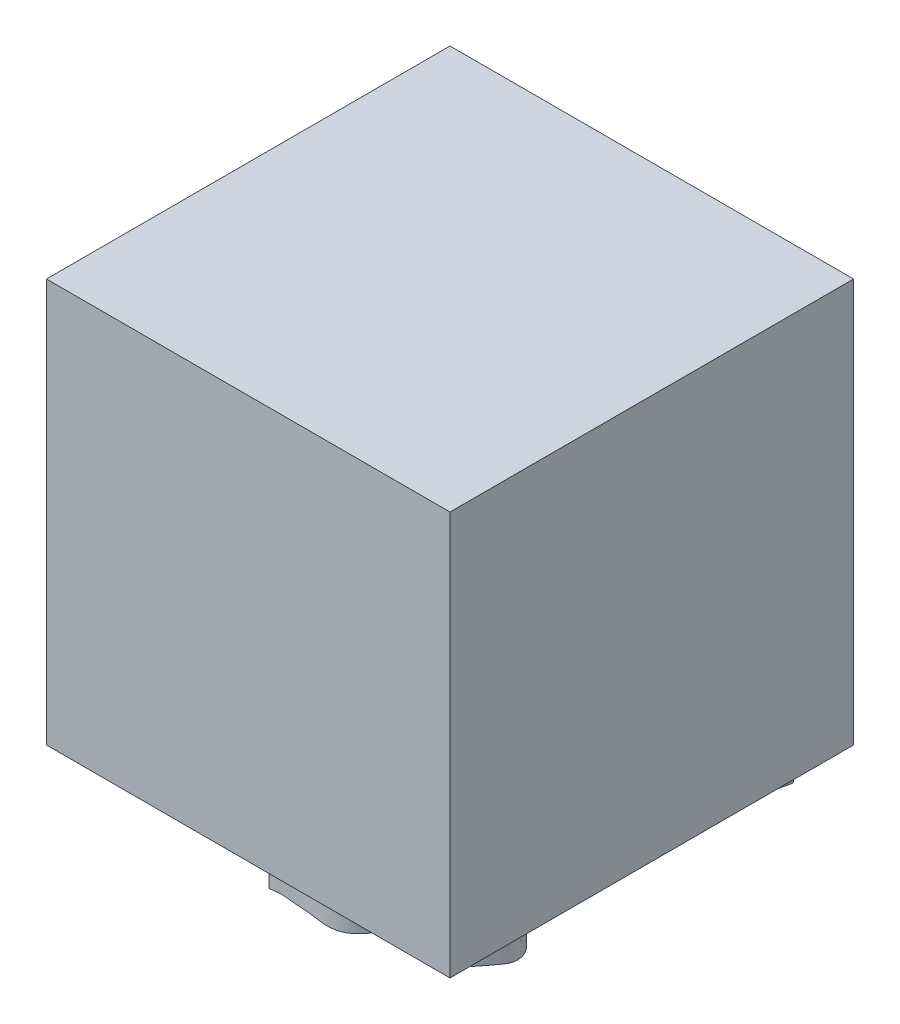
from build123d import *

# Parameters (mm, degrees)
SKETCH_1_W      = 30
SKETCH_1_H      = 30
EXTRUDE_1_DEPTH = 30
EXTRUDE_2_DEPTH = 2


# Read off the part's stored shape, not the designer's step: 凸台-拉伸2
with BuildPart() as part:
    # 草图1 → 凸台-拉伸1 (new body)
    with BuildSketch(Plane(origin=(0, 0, 0), x_dir=(1, 0, 0), z_dir=(0, 1, 0))):
        Rectangle(SKETCH_1_W, SKETCH_1_H)
    extrude(amount=EXTRUDE_1_DEPTH)

    # 凸台-拉伸2 outline → 凸台-拉伸2 (add)
    # profile 1 of 2: a face of its own
    with BuildSketch(Plane.XZ):
        with BuildLine():
            add(Edge.make_bspline(
                [(-13.383129853, 6.134534038), (-13.181366327, 5.93575651), (-12.867274267, 5.54796524), (-12.079132116, 4.657161283), (-11.807623673, 3.335272443), (-11.587139237, 1.803115303), (-11.867716298, 0.806122103), (-11.961759338, 0.059326092), (-11.759164715, -0.440455742), (-11.695903188, -1.15731165), (-11.642124039, -2.265903934), (-11.792882001, -3.54674406), (-11.575796977, -4.904415403), (-12.071223273, -5.805723015), (-12.332597916, -6.61760545), (-12.472668258, -7.218980129), (-12.83567184, -7.921330738), (-13.200015919, -8.790415544), (-13.277388127, -10.385758639), (-12.243021013, -11.523748828), (-11.439216308, -12.400372334), (-10.703185527, -12.748951411), (-10.026260605, -12.713901991), (-9.313176001, -12.755599802), (-9.063703334, -12.250645661), (-8.691879203, -11.80279125), (-9.006828704, -11.014583798), (-9.238633676, -9.914136684), (-9.514494687, -8.511613752), (-9.578092193, -7.34488793), (-9.943875857, -6.582555197), (-9.46918664, -6.188324117), (-9.256562453, -6.658057871), (-8.962585845, -6.904305479), (-8.645185325, -7.316273931), (-8.215215921, -7.816254507), (-7.41135075, -8.216713644), (-6.786209553, -7.701923393), (-6.243566969, -7.177141085), (-6.436709544, -6.399288017), (-6.074322045, -5.670316779), (-5.834027276, -4.475867145), (-5.536736735, -3.206002162), (-5.174780531, -1.676575793), (-5.138677076, -0.970781605), (-4.793609841, 0.029296885), (-5.044021744, -0.005450786), (-5.19992417, 0.018758136), (-5.409391736, -0.25247247), (-5.650870261, -0.631519069), (-6.012700387, -1.150524885), (-6.18356223, -1.625070899), (-6.555222011, -1.800540568), (-6.707863008, -1.574321625), (-6.637594321, -1.174984468), (-6.655654596, -0.473392508), (-6.405248703, 0.616679367), (-6.07567466, 2.806396524), (-4.845622983, 5.027159328), (-5.144656617, 7.50776442), (-5.88730179, 8.767657749), (-6.877063932, 9.325482537), (-7.758482248, 9.327111904), (-9.524328988, 9.348470045), (-10.818765715, 8.798676711), (-12.384682272, 8.740893748), (-12.377603502, 8.457139008), (-12.016469425, 8.32653571), (-11.644847347, 7.908228334), (-10.741602504, 7.541333852), (-9.917502565, 7.166454977), (-9.053068177, 7.022409664), (-8.67299867, 6.46135974), (-8.635697588, 5.851564512), (-8.501983422, 4.863556723), (-8.70119392, 3.561897946), (-8.587794364, 1.928647271), (-8.933555216, 0.992065681), (-9.25393439, 0.334512478), (-9.629683221, 0.531152004), (-9.935412132, 0.836423201), (-9.760980726, 1.617530612), (-9.984832595, 2.855548477), (-10.304182499, 4.214713154), (-10.383913787, 5.551170316), (-11.205001476, 6.283646192), (-12.106766443, 6.626599903), (-12.956592083, 6.946568213), (-13.534319036, 7.335873621), (-14.119901416, 7.493040163), (-14.453230652, 7.153568779), (-14.202260644, 6.958609773), (-13.931079451, 6.607908616), (-13.590553803, 6.338888219), (-13.383129853, 6.134534038)],
                knots=[0, 0, 0, 0, 0.010222128, 0.018375561, 0.042938758, 0.057426153, 0.074417442, 0.080481024, 0.084129039, 0.093794036, 0.106534631, 0.12458502, 0.140926375, 0.154761777, 0.160801818, 0.172145458, 0.177081694, 0.189575985, 0.206555342, 0.231806596, 0.242015497, 0.250182728, 0.26017762, 0.26747089, 0.273073801, 0.279154715, 0.287563769, 0.300689184, 0.321797877, 0.33840714, 0.344830246, 0.349074754, 0.354329207, 0.358683708, 0.363955277, 0.372810443, 0.38361728, 0.39133365, 0.400417293, 0.409121122, 0.417578243, 0.4294173, 0.453357415, 0.466386394, 0.483492603, 0.489109143, 0.490382495, 0.491655847, 0.494732957, 0.501149047, 0.509157568, 0.517224925, 0.519644666, 0.5213022, 0.525763983, 0.534051649, 0.546960815, 0.5662313, 0.615001599, 0.634691723, 0.654941183, 0.665952388, 0.67425363, 0.686776726, 0.729342599, 0.732229176, 0.73435143, 0.737238007, 0.744963128, 0.754739326, 0.771928272, 0.778639428, 0.78530344, 0.794585724, 0.800773104, 0.821588508, 0.842615964, 0.857850436, 0.861331191, 0.864686769, 0.870556633, 0.876290647, 0.891623839, 0.916642142, 0.927922076, 0.938277718, 0.95422713, 0.963451003, 0.970954303, 0.980294631, 0.982416885, 0.984836627, 0.989491093, 1, 1, 1, 1], degree=3))
        make_face()
    # profile 2 of 2: a face of its own
    with BuildSketch(Plane.XZ):
        with BuildLine():
            add(Edge.make_bspline(
                [(-4.50119841, 8.368104225), (-4.421267343, 8.242442305), (-4.089953235, 7.753552045), (-4.110395808, 6.718418585), (-4.270473958, 5.444632571), (-4.928595796, 4.216333693), (-5.008427603, 2.683581322), (-4.138965637, 1.933365024), (-3.738797064, 1.389375162), (-3.424867695, 1.051640822), (-3.539377192, 0.598950721), (-3.089575654, 0.667924204), (-2.745910357, 0.683697305), (-2.108542382, 0.502647834), (-2.054471136, 1.001605586), (-2.033180779, 1.306352596), (-2.142592913, 1.655295226), (-1.829450912, 1.836539126), (-1.646470107, 1.998728755), (-1.308982146, 2.021217487), (-1.370129793, 1.53653638), (-0.946270894, 1.343091118), (-0.509352695, 0.960008867), (0.513545554, 0.800789656), (1.420203232, 0.880192284), (2.450188885, 1.258896672), (2.643767506, 0.648934644), (2.424578235, 0.172690645), (2.08859835, -0.311824571), (1.529493329, -0.658837951), (1.530812461, -1.25187124), (1.193028895, -1.713505614), (0.86914977, -2.740403477), (0.484599827, -4.104804509), (-0.240765147, -5.628822261), (-0.111122781, -7.111041854), (0.677425641, -8.43756388), (1.456216264, -9.288843187), (2.151768221, -10.236205726), (2.688590906, -10.003569502), (2.948869962, -9.724242636), (3.255836085, -9.426370644), (3.805072822, -9.287655186), (4.501793186, -9.175170465), (5.042335983, -9.028857953), (5.540309526, -8.866642727), (5.793726968, -9.272983774), (5.758180752, -9.662860125), (5.848353036, -10.253304094), (5.250705527, -10.21305509), (4.525667529, -10.430465147), (2.861396914, -10.776311623), (0.59678645, -11.444937763), (-1.480780819, -12.297273887), (-3.007310877, -12.368517698), (-3.603121374, -12.108704281), (-4.331277593, -12.039344968), (-3.67318099, -12.709549048), (-3.369274027, -13.215913063), (-2.402478444, -13.582961551), (-1.845836441, -14.419511434), (-0.895266314, -14.374209624), (-0.028861203, -14.074052359), (1.114449197, -13.619372437), (3.420838323, -12.777756991), (6.026943444, -11.838491549), (8.953976952, -11.992233196), (10.595374309, -12.584546535), (11.984102093, -13.202954818), (12.676211216, -12.646218282), (13.278714449, -12.436698312), (13.025041637, -11.608267347), (12.918001246, -10.832163396), (12.164591195, -10.166249858), (11.354855168, -9.513605609), (9.917139475, -9.378676096), (8.879333423, -9.497891564), (7.912837663, -9.635637835), (7.747574637, -9.143502549), (7.894582205, -8.646754888), (8.24845746, -7.796911509), (8.30128296, -6.383654884), (8.318928271, -4.529152549), (8.557191592, -2.820739157), (8.531349634, -1.258572809), (8.496174442, 0.478039), (6.652455245, 1.043661265), (5.389191075, 0.612987969), (4.403130513, 0.275601592), (3.731883621, 0.038500966), (2.977727964, -0.098829223), (3.242723312, 0.804104067), (3.923475485, 1.377089299), (5.128023135, 2.066473246), (6.737429966, 2.73757152), (8.334167842, 2.922909117), (10.759339832, 2.963814337), (10.098061399, 4.602720248), (9.23158513, 5.025159928), (8.618047863, 5.639519616), (7.774840142, 5.693627424), (7.013517258, 5.248140714), (5.791426966, 4.823763251), (4.51402785, 3.59816331), (2.377698375, 2.888605693), (0.543433022, 2.108750186), (-1.076067917, 2.563965492), (-1.329134979, 3.767983556), (-1.274156829, 4.673399683), (-1.262884213, 5.661718571), (-0.457576288, 6.339326646), (0.571265424, 6.186667197), (1.510306296, 6.920846857), (2.077377437, 6.254146574), (2.598447577, 5.749246074), (3.560141768, 5.847012665), (4.356137642, 6.136511878), (5.323003354, 6.247988713), (5.885158184, 7.109261916), (6.628430714, 7.694968448), (7.623882732, 8.478262103), (8.239044441, 9.194181211), (9.316661403, 8.92348096), (9.121806626, 8.658614555), (9.103816663, 8.336859026), (8.562434118, 8.186343901), (8.21944458, 7.770963694), (7.484024252, 7.385772699), (7.174125979, 6.766899131), (6.4509737, 6.526680192), (6.570720628, 6.138105142), (7.063084411, 6.092354739), (7.781210208, 6.555961505), (8.804202229, 6.866027329), (9.942482548, 7.362057793), (11.066057514, 7.440707108), (12.300687027, 7.656349153), (13.822345326, 7.72370929), (14.695854417, 9.552955948), (13.591487707, 10.665661244), (12.985511644, 11.682887806), (12.312163797, 11.660947322), (12.014366636, 11.464750208), (11.56575605, 11.065460931), (10.642894195, 10.789150685), (9.768279209, 10.23715313), (9.091430517, 9.841287846), (8.600113423, 9.817786296), (8.392728218, 10.089009504), (8.229605727, 10.349171929), (8.219101975, 10.66148867), (8.208808137, 11.046198096), (8.285558907, 11.436380634), (8.091694195, 11.810641149), (7.827766883, 12.147980242), (7.500209902, 12.663152401), (6.988048873, 13.280948354), (6.24021491, 14.11130217), (4.919768332, 14.299121026), (3.581614267, 13.999524), (2.365665456, 14.000664313), (1.363265057, 13.835286826), (0.827479367, 13.933377649), (0.458334437, 13.981927858), (0.339572044, 13.713884459), (0.304302849, 13.357319993), (0.668765, 12.919513469), (1.034974959, 12.310269144), (1.611761966, 11.838085475), (2.101367505, 11.497492836), (2.545580794, 11.064899112), (2.91129437, 10.662532132), (3.325192662, 10.228175284), (3.213253312, 9.750299077), (3.063130289, 9.284237295), (2.763836956, 8.499229947), (1.659868313, 8.317666162), (0.726086325, 7.559479612), (-0.179496615, 7.230063909), (-1.1465106, 6.755401364), (-1.562556364, 7.591762245), (-2.00816253, 8.209879833), (-1.926388727, 8.903987432), (-2.338552825, 9.143757353), (-2.598460169, 8.984883548), (-2.862798882, 8.999968336), (-3.316156027, 9.068092924), (-3.93665564, 9.166518852), (-4.437806526, 9.784907641), (-5.169107863, 9.532635682), (-4.966390386, 9.073972553), (-4.767613028, 8.850202273), (-4.644316047, 8.599458669), (-4.554105112, 8.451280365), (-4.50119841, 8.368104225)],
                knots=[0, 0, 0, 0, 0.002634237, 0.010307022, 0.017306227, 0.025329708, 0.035131521, 0.041057825, 0.044793168, 0.047146142, 0.04923092, 0.050158691, 0.053869774, 0.056756172, 0.058908664, 0.060970377, 0.062725862, 0.064403975, 0.066526638, 0.067248238, 0.069661411, 0.072144042, 0.074888909, 0.079989305, 0.089324107, 0.092842636, 0.09571427, 0.097996168, 0.102119594, 0.10620418, 0.108407899, 0.111957998, 0.116036075, 0.127413387, 0.13719295, 0.145368186, 0.152610776, 0.163767862, 0.167569473, 0.170503342, 0.172472791, 0.174518982, 0.177909858, 0.182216074, 0.187017033, 0.188169566, 0.190875441, 0.193255358, 0.195840733, 0.199240997, 0.20104131, 0.209842313, 0.228760706, 0.242979053, 0.249988877, 0.2540395, 0.255895042, 0.259643165, 0.263590148, 0.268398847, 0.276607598, 0.279184739, 0.284537257, 0.292922753, 0.300946234, 0.328125288, 0.341345997, 0.351223409, 0.360462667, 0.364107295, 0.36679544, 0.370100617, 0.376718201, 0.381165245, 0.387169928, 0.395016635, 0.405152633, 0.407738008, 0.40976856, 0.412903787, 0.416946533, 0.425974034, 0.437526987, 0.450042875, 0.456124928, 0.465808945, 0.477488144, 0.482913623, 0.489890016, 0.495159313, 0.497427197, 0.50007953, 0.507023096, 0.514784699, 0.524126329, 0.537042924, 0.54747955, 0.553771153, 0.560661717, 0.56517988, 0.568390464, 0.574785099, 0.580416255, 0.591226003, 0.6052096, 0.619895383, 0.626131512, 0.631249587, 0.639703238, 0.642925386, 0.648175675, 0.655656312, 0.661198065, 0.664788347, 0.669200605, 0.673736374, 0.680536902, 0.684813403, 0.689989288, 0.697552676, 0.701755714, 0.712369031, 0.714213083, 0.714904603, 0.71739578, 0.719378672, 0.72379093, 0.72690746, 0.733619911, 0.736260192, 0.737336437, 0.739687152, 0.743477565, 0.752589426, 0.758393432, 0.765376676, 0.772243294, 0.780969115, 0.790653132, 0.799846846, 0.807141931, 0.809103269, 0.81099567, 0.813346385, 0.819711036, 0.827600961, 0.831662065, 0.833623403, 0.835518609, 0.837271065, 0.839035607, 0.840891149, 0.84418989, 0.845665852, 0.848182493, 0.851813976, 0.856434468, 0.862488501, 0.871020356, 0.878295749, 0.886874185, 0.89255887, 0.895883282, 0.896811052, 0.898669455, 0.900013528, 0.903197523, 0.90791925, 0.912884513, 0.916121468, 0.918528026, 0.923778315, 0.926151525, 0.928326119, 0.931782179, 0.935239777, 0.942247326, 0.949319032, 0.956238068, 0.960288691, 0.96547688, 0.969303566, 0.974487657, 0.975409683, 0.977010002, 0.979280228, 0.980009154, 0.985163436, 0.989959966, 0.992681505, 0.995131823, 0.996905375, 0.998256388, 1, 1, 1, 1], degree=3))
        make_face()
        with BuildLine():
            add(Edge.make_bspline(
                [(3.054550735, -3.512490741), (2.900400953, -3.600828407), (2.599775468, -3.784513882), (2.524197751, -4.481808718), (2.456218006, -5.161526552), (2.542401146, -5.832845029), (2.693193743, -6.228018637), (2.980491754, -6.436207329), (3.216534232, -6.215069345), (3.588670944, -5.829910563), (3.886089356, -5.070515591), (4.100336493, -4.159121748), (3.778525189, -3.594509901), (3.396460498, -3.322477288), (3.169423857, -3.446661109), (3.054550735, -3.512490741)],
                knots=[0, 0, 0, 0, 0.069290798, 0.141637008, 0.273211585, 0.364062615, 0.420649684, 0.450133274, 0.492716806, 0.532085679, 0.68456559, 0.824076384, 0.901323525, 0.948364181, 1, 1, 1, 1], degree=3))
        make_face(mode=Mode.SUBTRACT)
        with BuildLine():
            add(Edge.make_bspline(
                [(4.182966733, -7.17493582), (4.096335728, -7.258039687), (3.938594575, -7.387767007), (3.760634835, -7.75495466), (4.219634837, -7.88170792), (4.644981271, -7.663254916), (5.33824851, -7.322266751), (5.994343697, -6.7225459), (6.088956657, -6.032166065), (6.205165643, -5.533305545), (5.820049655, -5.362923588), (5.495261007, -5.668820696), (5.114705514, -6.121398649), (4.654413436, -6.641942964), (4.323719127, -7.039914088), (4.182966733, -7.17493582)],
                knots=[0, 0, 0, 0, 0.05359564, 0.094274906, 0.132493413, 0.210594999, 0.302869075, 0.467549815, 0.552678566, 0.615929091, 0.647734389, 0.703465944, 0.783017543, 0.912921307, 1, 1, 1, 1], degree=3))
        make_face(mode=Mode.SUBTRACT)
        with BuildLine():
            add(Edge.make_bspline(
                [(3.438445611, -2.468201132), (3.333678584, -2.536674852), (3.075130573, -2.685991308), (3.55189263, -2.95765635), (3.952038428, -2.85901467), (4.493825561, -2.904402713), (5.067896478, -2.845277046), (5.881901753, -3.069626742), (6.08706508, -2.138209752), (5.630841522, -1.355607927), (4.776322687, -1.715279316), (4.020786146, -1.97458614), (3.693973821, -2.301192792), (3.438445611, -2.468201132)],
                knots=[0, 0, 0, 0, 0.045811434, 0.097817842, 0.161379065, 0.241245581, 0.328841115, 0.429318345, 0.547641529, 0.645360351, 0.769533392, 0.888265287, 1, 1, 1, 1], degree=3))
        make_face(mode=Mode.SUBTRACT)
    extrude(amount=EXTRUDE_2_DEPTH)


solid = part.part
